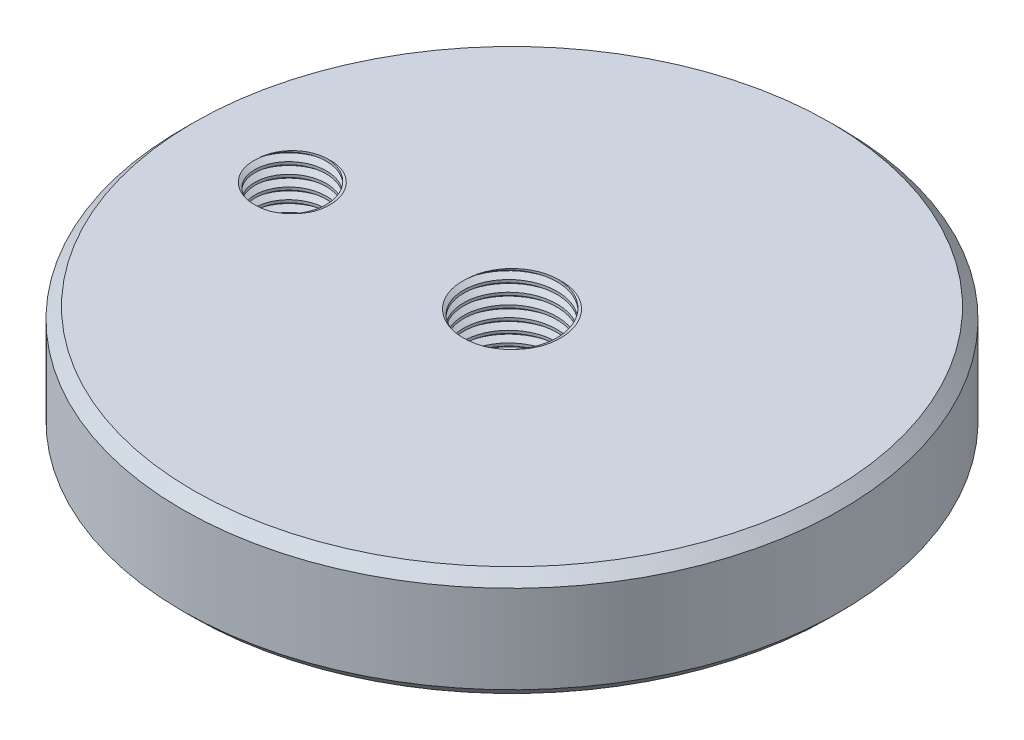
from build123d import *

# Parameters (mm, degrees)
SKETCH1_R           = 30
SKETCH1_R_2         = 3.25
SKETCH1_R_3         = 4.25
BOSS_EXTRUDE1_DEPTH = 10
THREAD1_PITCH       = 1
THREAD2_PITCH       = 1
CHAMFER1_SIZE       = 1


with BuildPart() as part:
    # Sketch1 → Boss-Extrude1 (new body)
    with BuildSketch(Plane(origin=(0, 0, 0), x_dir=(1, 0, 0), z_dir=(0, 1, 0))):
        with Locations(Location((0, 0, 0), (0, 0, 270))):
            Circle(SKETCH1_R)
        with Locations(Location((-20, 0, 0), (0, 0, 270))):
            Circle(SKETCH1_R_2, mode=Mode.SUBTRACT)
        with Locations(Location((0, 0, 0), (0, 0, 270))):
            Circle(SKETCH1_R_3, mode=Mode.SUBTRACT)
    extrude(amount=BOSS_EXTRUDE1_DEPTH)

    # Thread1: the profile of Thread Profile1 profile screwed along a right-hand helix of 15 turns, 8 arcs to a turn; built about Z, then put on its axis
    thread1_z = Axis((0, 0, 0), (0, 0, 1))
    thread1_corners = [(3.2497, 0, -0.000173205), (3.791265875, 0, 0.312499999), (3.791265875, 0, 0.437499999), (3.2497, 0, 0.750173202)]
    with BuildLine(mode=Mode.PRIVATE) as thread1_profile:
        Line(thread1_corners[0], thread1_corners[1])
        Line(thread1_corners[1], thread1_corners[2])
        Line(thread1_corners[2], thread1_corners[3])
        Line(thread1_corners[3], thread1_corners[0])
    thread1_cap = Face(thread1_profile.wire())
    thread1_turn_angles = [0, 22.5, 45, 67.5, 90, 112.5, 135, 157.5, 180, 202.5, 225, 247.5, 270, 292.5, 315, 337.5, 360]
    thread1_turn_weights = [1, 0.9238795325112867, 1, 0.9238795325112867, 1, 0.9238795325112867, 1, 0.9238795325112867, 1, 0.9238795325112867, 1, 0.9238795325112867, 1, 0.9238795325112867, 1, 0.9238795325112867, 1]
    thread1_turn_rails = [Edge.make_bspline([Vector(p[0], p[1], 0).rotate(thread1_z, thread1_turn_angles[k]) / thread1_turn_weights[k] + Vector(0, 0, p[2] + THREAD1_PITCH * thread1_turn_angles[k] / 360) for k in range(17)], [0, 0, 0, 1, 1, 2, 2, 3, 3, 4, 4, 5, 5, 6, 6, 7, 7, 8, 8, 8], 2, thread1_turn_weights) for p in thread1_corners]
    thread1_turn_sides = [Face.make_surface_from_curves(thread1_turn_rails[p[0]], thread1_turn_rails[p[1]]) for p in [(0, 1), (1, 2), (2, 3), (3, 0)]]
    thread1 = Plane(origin=(-20, 11, 0), x_dir=(-1, 0, 0), z_dir=(0, -1, 0)) * Solid(Shell([*[p.moved(Location((0, 0, THREAD1_PITCH * i))) for i in range(15) for p in thread1_turn_sides], thread1_cap, thread1_cap.rotate(thread1_z, 5400).moved(Location((0, 0, THREAD1_PITCH * 5400 / 360)))]))
    add(thread1, mode=Mode.SUBTRACT)

    # Thread2: the profile of Thread Profile2 profile screwed along a right-hand helix of 15 turns, 8 arcs to a turn; built about Z, then put on its axis
    thread2_z = Axis((0, 0, 0), (0, 0, 1))
    thread2_corners = [(4.2497, 0, -0.000173205), (4.791265875, 0, 0.312499999), (4.791265875, 0, 0.437499999), (4.2497, 0, 0.750173202)]
    with BuildLine(mode=Mode.PRIVATE) as thread2_profile:
        Line(thread2_corners[0], thread2_corners[1])
        Line(thread2_corners[1], thread2_corners[2])
        Line(thread2_corners[2], thread2_corners[3])
        Line(thread2_corners[3], thread2_corners[0])
    thread2_cap = Face(thread2_profile.wire())
    thread2_turn_angles = [0, 22.5, 45, 67.5, 90, 112.5, 135, 157.5, 180, 202.5, 225, 247.5, 270, 292.5, 315, 337.5, 360]
    thread2_turn_weights = [1, 0.9238795325112867, 1, 0.9238795325112867, 1, 0.9238795325112867, 1, 0.9238795325112867, 1, 0.9238795325112867, 1, 0.9238795325112867, 1, 0.9238795325112867, 1, 0.9238795325112867, 1]
    thread2_turn_rails = [Edge.make_bspline([Vector(p[0], p[1], 0).rotate(thread2_z, thread2_turn_angles[k]) / thread2_turn_weights[k] + Vector(0, 0, p[2] + THREAD2_PITCH * thread2_turn_angles[k] / 360) for k in range(17)], [0, 0, 0, 1, 1, 2, 2, 3, 3, 4, 4, 5, 5, 6, 6, 7, 7, 8, 8, 8], 2, thread2_turn_weights) for p in thread2_corners]
    thread2_turn_sides = [Face.make_surface_from_curves(thread2_turn_rails[p[0]], thread2_turn_rails[p[1]]) for p in [(0, 1), (1, 2), (2, 3), (3, 0)]]
    thread2 = Plane(origin=(0, 11, 0), x_dir=(-1, 0, 0), z_dir=(0, -1, 0)) * Solid(Shell([*[p.moved(Location((0, 0, THREAD2_PITCH * i))) for i in range(15) for p in thread2_turn_sides], thread2_cap, thread2_cap.rotate(thread2_z, 5400).moved(Location((0, 0, THREAD2_PITCH * 5400 / 360)))]))
    add(thread2, mode=Mode.SUBTRACT)

    # Chamfer1
    chamfer1_edges = [part.edges().sort_by_distance(p)[0] for p in [
        (0, 0, -30),
        (0, 10, -30),
    ]]
    chamfer(chamfer1_edges, length=CHAMFER1_SIZE)


solid = part.part
